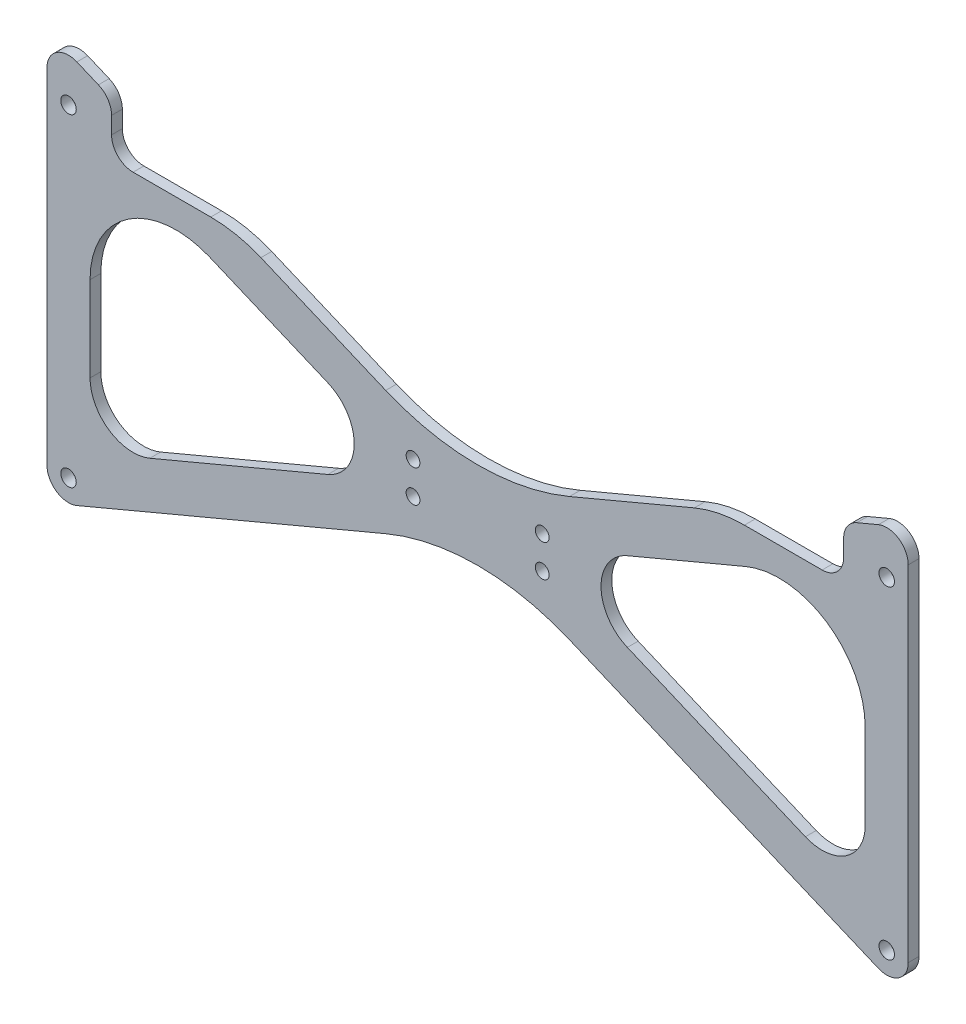
from build123d import *

# Parameters (mm, degrees)
BOSS_EXTRUDE1_DEPTH = 3.175
SKETCH2_R           = 2.286
CUT_EXTRUDE1_DEPTH  = 140.30255965
FILLET1_R           = 12.7
FILLET5_R           = 69.85
FILLET8_R           = 25.4
SKETCH5_R           = 2.032
CUT_EXTRUDE3_DEPTH  = 140.30255965
CUT_EXTRUDE4_DEPTH  = 140.30255965
FILLET6_R           = 6.35
FILLET9_R           = 38.1


with BuildPart() as part:
    # Sketch1 → Boss-Extrude1 (new body)
    with BuildSketch(Plane.XY):
        with BuildLine():
            Line((-118.18583805, 56.652384632), (0, 6.889926506))
            Line((0, 6.889926506), (118.18583805, 56.652384632))
            ThreePointArc((118.18583805, 56.652384632), (124.162482855, 56.090081681), (127, 50.8))
            Line((127, 50.8), (127, -50.8))
            ThreePointArc((127, -50.8), (124.162482855, -56.090081681), (118.18583805, -56.652384632))
            Line((118.18583805, -56.652384632), (0, -6.889926506))
            Line((0, -6.889926506), (-118.18583805, -56.652384632))
            ThreePointArc((-118.18583805, -56.652384632), (-124.162482855, -56.090081681), (-127, -50.8))
            Line((-127, -50.8), (-127, 50.8))
            ThreePointArc((-127, 50.8), (-124.162482855, 56.090081681), (-118.18583805, 56.652384632))
        make_face()
        Polygon((-114.3, -41.236389284), (-16.363575452, 0), (-114.3, 41.236389284), align=None, mode=Mode.SUBTRACT)
        Polygon((16.363575452, 0), (114.3, 41.236389284), (114.3, -41.236389284), align=None, mode=Mode.SUBTRACT)
    extrude(amount=BOSS_EXTRUDE1_DEPTH)

    # Sketch2 → Cut-Extrude1 (cut, through all)
    with BuildSketch(Plane.XY.offset(3.175)):
        with Locations((-120.65, 44.45)):
            Circle(SKETCH2_R)
        with Locations((-120.65, -50.8)):
            Circle(SKETCH2_R)
        with Locations((120.65, -50.8)):
            Circle(SKETCH2_R)
        with Locations((120.65, 44.45)):
            Circle(SKETCH2_R)
    extrude(amount=-CUT_EXTRUDE1_DEPTH, mode=Mode.SUBTRACT)

    # Fillet1
    fillet1_edges = [part.edges().sort_by_distance(p)[0] for p in [
        (114.3, -41.236389284, 1.5875),
        (16.363575452, 0, 1.5875),
        (-114.3, -41.236389284, 1.5875),
        (-16.363575452, 0, 1.5875),
    ]]
    fillet(fillet1_edges, radius=FILLET1_R)

    # Fillet5
    fillet5_edges = [part.edges().sort_by_distance(p)[0] for p in [
        (0, -6.889926506, 1.5875),
        (0, 6.889926506, 1.5875),
    ]]
    fillet(fillet5_edges, radius=FILLET5_R)

    # Fillet8
    fillet8_edges = [part.edges().sort_by_distance(p)[0] for p in [
        (114.3, 41.236389284, 1.5875),
        (-114.3, 41.236389284, 1.5875),
    ]]
    fillet(fillet8_edges, radius=FILLET8_R)

    # Sketch5 → Cut-Extrude3 (cut, through all)
    with BuildSketch(Plane.XY.offset(3.175)):
        with Locations((-19.05, 4.7625)):
            Circle(SKETCH5_R)
        with Locations((-19.05, -4.7625)):
            Circle(SKETCH5_R)
    cut_extrude3 = extrude(amount=-CUT_EXTRUDE3_DEPTH, mode=Mode.SUBTRACT)

    # Mirror1: Cut-Extrude3 across plane
    add(cut_extrude3.mirror(Plane(origin=(0, 0, 0), x_dir=(0, 0, 1), z_dir=(1, 0, 0))), mode=Mode.SUBTRACT)

    # Sketch6 → Cut-Extrude4 (cut, through all)
    with BuildSketch(Plane.XY.offset(3.175)):
        Polygon((-107.95, 52.342558085), (-107.95, 36.785058085), (-71.0009375, 36.785058085), align=None)
    cut_extrude4 = extrude(amount=-CUT_EXTRUDE4_DEPTH, mode=Mode.SUBTRACT)

    # Mirror2: Cut-Extrude4 across plane
    add(cut_extrude4.mirror(Plane(origin=(0, 0, 0), x_dir=(0, 0, 1), z_dir=(1, 0, 0))), mode=Mode.SUBTRACT)

    # Fillet6
    fillet6_edges = [part.edges().sort_by_distance(p)[0] for p in [
        (-107.95, 52.342558085, 1.5875),
        (-107.95, 36.785058085, 1.5875),
        (107.95, 52.342558085, 1.5875),
        (107.95, 36.785058085, 1.5875),
    ]]
    fillet(fillet6_edges, radius=FILLET6_R)

    # Fillet9
    fillet9_edges = [part.edges().sort_by_distance(p)[0] for p in [
        (71.0009375, 36.785058085, 1.5875),
        (-71.0009375, 36.785058085, 1.5875),
    ]]
    fillet(fillet9_edges, radius=FILLET9_R)


solid = part.part
